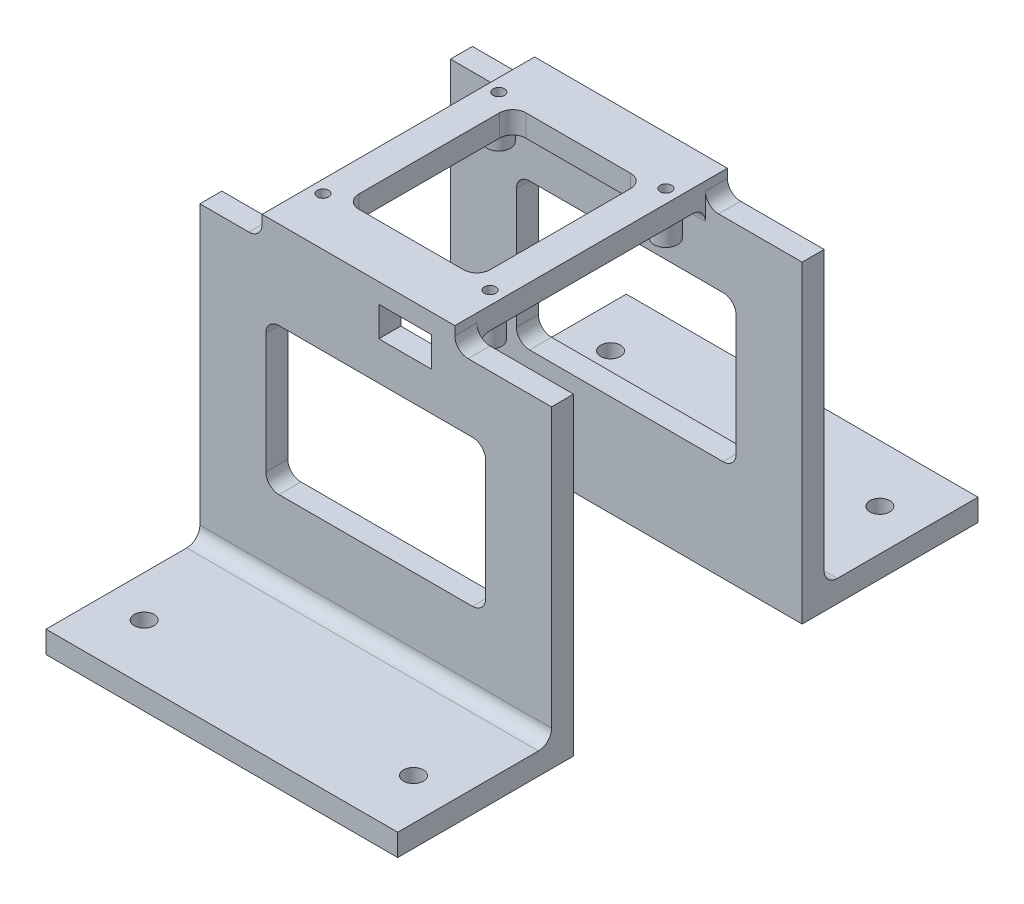
from build123d import *

# Parameters (mm, degrees)
SKETCH1_W               = 80
SKETCH1_H               = 40
SKETCH1_R               = 2.25
BOSS_EXTRUDE1_DEPTH     = 5
BOSS_EXTRUDE1_2_DEPTH   = 5
SKETCH2_W               = 80
SKETCH2_H               = 5
BOSS_EXTRUDE2_DEPTH     = 66.3
SKETCH3_W               = 43.85
SKETCH3_H               = 62
BOSS_EXTRUDE3_DEPTH     = 5
SKETCH5_W               = 29.85
SKETCH5_H               = 38
CUT_EXTRUDE2_DEPTH      = 10
CUT_EXTRUDE1_REACH      = 110.525
SKETCH4_R               = 1.3
FILLET1_R               = 3
FILLET2_R               = 3
CUT_EXTRUDE3_DEPTH      = 130.733149195
CUT_EXTRUDE3_DEPTH_BACK = 130.733149195
SKETCH6_W               = 50
SKETCH6_H               = 33.3
FILLET3_R               = 3
SKETCH9_R               = 2.65
SKETCH9_R_2             = 1.05
BOSS_EXTRUDE5_DEPTH     = 4.75
SKETCH10_W              = 12
SKETCH10_H              = 6.8
CUT_EXTRUDE4_DEPTH      = 8


with BuildPart() as part:
    # Sketch1 → Boss-Extrude1 (new body)
    with BuildSketch(Plane(origin=(0, 0, 0), x_dir=(1, 0, 0), z_dir=(0, 1, 0))):
        with Locations((0, 46)):
            Rectangle(SKETCH1_W, SKETCH1_H)
        with Locations((-30.625, 53.044055982)):
            Circle(SKETCH1_R, mode=Mode.SUBTRACT)
        with Locations((30.625, 53.044055982)):
            Circle(SKETCH1_R, mode=Mode.SUBTRACT)
    extrude(amount=BOSS_EXTRUDE1_DEPTH)



with BuildPart() as body_2:
    # Sketch1 → Boss-Extrude1 2 (new body)
    with BuildSketch(Plane(origin=(0, 0, 0), x_dir=(1, 0, 0), z_dir=(0, 1, 0))):
        with Locations((0, -46)):
            Rectangle(SKETCH1_W, SKETCH1_H)
        with Locations((30.625, -53.044055982)):
            Circle(SKETCH1_R, mode=Mode.SUBTRACT)
        with Locations((-30.625, -53.044055982)):
            Circle(SKETCH1_R, mode=Mode.SUBTRACT)
    extrude(amount=BOSS_EXTRUDE1_2_DEPTH)


with BuildPart() as part_1:
    add(part.part)

    add(body_2.part)  # Boss-Extrude2 merges body 2
    # Sketch2 → Boss-Extrude2 (add)
    with BuildSketch(Plane(origin=(0, 5, 0), x_dir=(1, 0, 0), z_dir=(0, 1, 0))):
        with Locations((0, 28.5)):
            Rectangle(SKETCH2_W, SKETCH2_H)
        with Locations((0, -28.5)):
            Rectangle(SKETCH2_W, SKETCH2_H)
    extrude(amount=BOSS_EXTRUDE2_DEPTH)

    # Sketch3 → Boss-Extrude3 (add)
    with BuildSketch(Plane(origin=(0, 71.3, 0), x_dir=(1, 0, 0), z_dir=(0, 1, 0))):
        with Locations((-3.925, 0)):
            Rectangle(SKETCH3_W, SKETCH3_H)
    extrude(amount=BOSS_EXTRUDE3_DEPTH)

    # Sketch5 → Cut-Extrude2 (cut)
    with BuildSketch(Plane.XZ.offset(-71.3)):
        with Locations((-3.925, 0)):
            Rectangle(SKETCH5_W, SKETCH5_H)
    extrude(amount=-CUT_EXTRUDE2_DEPTH, mode=Mode.SUBTRACT)

    # Sketch4 → Cut-Extrude1 (cut, up to next)
    with BuildSketch(Plane(origin=(0, 76.3, 0), x_dir=(1, 0, 0), z_dir=(0, 1, 0)), mode=Mode.PRIVATE) as cut_extrude1_sk1:
        with Locations((-23, 20)):
            Circle(SKETCH4_R)
    cut_extrude1_tool1 = extrude(cut_extrude1_sk1.sketch, amount=-CUT_EXTRUDE1_REACH, mode=Mode.PRIVATE) & part_1.part
    # Sketch4 → Cut-Extrude1 (cut, up to next)
    with BuildSketch(Plane(origin=(0, 76.3, 0), x_dir=(1, 0, 0), z_dir=(0, 1, 0)), mode=Mode.PRIVATE) as cut_extrude1_sk2:
        with Locations((15, 20)):
            Circle(SKETCH4_R)
    cut_extrude1_tool2 = extrude(cut_extrude1_sk2.sketch, amount=-CUT_EXTRUDE1_REACH, mode=Mode.PRIVATE) & part_1.part
    # Sketch4 → Cut-Extrude1 (cut, up to next)
    with BuildSketch(Plane(origin=(0, 76.3, 0), x_dir=(1, 0, 0), z_dir=(0, 1, 0)), mode=Mode.PRIVATE) as cut_extrude1_sk3:
        with Locations((15, -20)):
            Circle(SKETCH4_R)
    cut_extrude1_tool3 = extrude(cut_extrude1_sk3.sketch, amount=-CUT_EXTRUDE1_REACH, mode=Mode.PRIVATE) & part_1.part
    # Sketch4 → Cut-Extrude1 (cut, up to next)
    with BuildSketch(Plane(origin=(0, 76.3, 0), x_dir=(1, 0, 0), z_dir=(0, 1, 0)), mode=Mode.PRIVATE) as cut_extrude1_sk4:
        with Locations((-23, -20)):
            Circle(SKETCH4_R)
    cut_extrude1_tool4 = extrude(cut_extrude1_sk4.sketch, amount=-CUT_EXTRUDE1_REACH, mode=Mode.PRIVATE) & part_1.part
    add(cut_extrude1_tool1.solids().sort_by_distance((-23, 76.3, -20))[0], mode=Mode.SUBTRACT)
    add(cut_extrude1_tool2.solids().sort_by_distance((15, 76.3, -20))[0], mode=Mode.SUBTRACT)
    add(cut_extrude1_tool3.solids().sort_by_distance((15, 76.3, 20))[0], mode=Mode.SUBTRACT)
    add(cut_extrude1_tool4.solids().sort_by_distance((-23, 76.3, 20))[0], mode=Mode.SUBTRACT)

    # Fillet1
    fillet1_edges = [part_1.edges().sort_by_distance(p)[0] for p in [
        (-3.925, 71.3, -26),
        (-3.925, 71.3, 26),
        (0, 5, -31),
        (0, 5, 31),
    ]]
    fillet(fillet1_edges, radius=FILLET1_R)

    # Fillet2
    fillet2_edges = [part_1.edges().sort_by_distance(p)[0] for p in [
        (18, 71.3, -28.5),
        (-25.85, 71.3, -28.5),
        (-25.85, 71.3, 28.5),
        (18, 71.3, 28.5),
    ]]
    fillet(fillet2_edges, radius=FILLET2_R)

    # Sketch6 → Cut-Extrude3 (cut, two sides: drawn at the far end of the back side and taken through both)
    with BuildSketch(Plane.XY.offset(31).offset(-CUT_EXTRUDE3_DEPTH_BACK)):
        with Locations((0, 39.65)):
            Rectangle(SKETCH6_W, SKETCH6_H)
    extrude(amount=CUT_EXTRUDE3_DEPTH + CUT_EXTRUDE3_DEPTH_BACK, mode=Mode.SUBTRACT)

    # Fillet3
    fillet3_edges = [part_1.edges().sort_by_distance(p)[0] for p in [
        (-25, 56.3, -28.5),
        (25, 56.3, -28.5),
        (25, 23, -28.5),
        (-25, 23, -28.5),
        (-25, 56.3, 28.5),
        (25, 56.3, 28.5),
        (25, 23, 28.5),
        (-25, 23, 28.5),
        (-18.85, 73.8, -19),
        (-18.85, 73.8, 19),
        (11, 73.8, 19),
        (11, 73.8, -19),
    ]]
    fillet(fillet3_edges, radius=FILLET3_R)

    # Sketch9 → Boss-Extrude5 (add)
    # profile 1 of 4: a face of its own
    with BuildSketch(Plane.XZ.offset(-71.3)):
        with Locations((-23, 20)):
            Circle(SKETCH9_R)
        with Locations((-23, 20)):
            Circle(SKETCH9_R_2, mode=Mode.SUBTRACT)
    # profile 2 of 4: a face of its own
    with BuildSketch(Plane.XZ.offset(-71.3)):
        with Locations((-23, -20)):
            Circle(SKETCH9_R)
        with Locations((-23, -20)):
            Circle(SKETCH9_R_2, mode=Mode.SUBTRACT)
    # profile 3 of 4: a face of its own
    with BuildSketch(Plane.XZ.offset(-71.3)):
        with Locations((15, 20)):
            Circle(SKETCH9_R)
        with Locations((15, 20)):
            Circle(SKETCH9_R_2, mode=Mode.SUBTRACT)
    # profile 4 of 4: a face of its own
    with BuildSketch(Plane.XZ.offset(-71.3)):
        with Locations((15, -20)):
            Circle(SKETCH9_R)
        with Locations((15, -20)):
            Circle(SKETCH9_R_2, mode=Mode.SUBTRACT)
    extrude(amount=BOSS_EXTRUDE5_DEPTH)

    # Sketch10 → Cut-Extrude4 (cut)
    with BuildSketch(Plane.XY.offset(31)):
        with Locations((6.7, 68.45)):
            Rectangle(SKETCH10_W, SKETCH10_H)
    extrude(amount=-CUT_EXTRUDE4_DEPTH, mode=Mode.SUBTRACT)


solid = part_1.part
